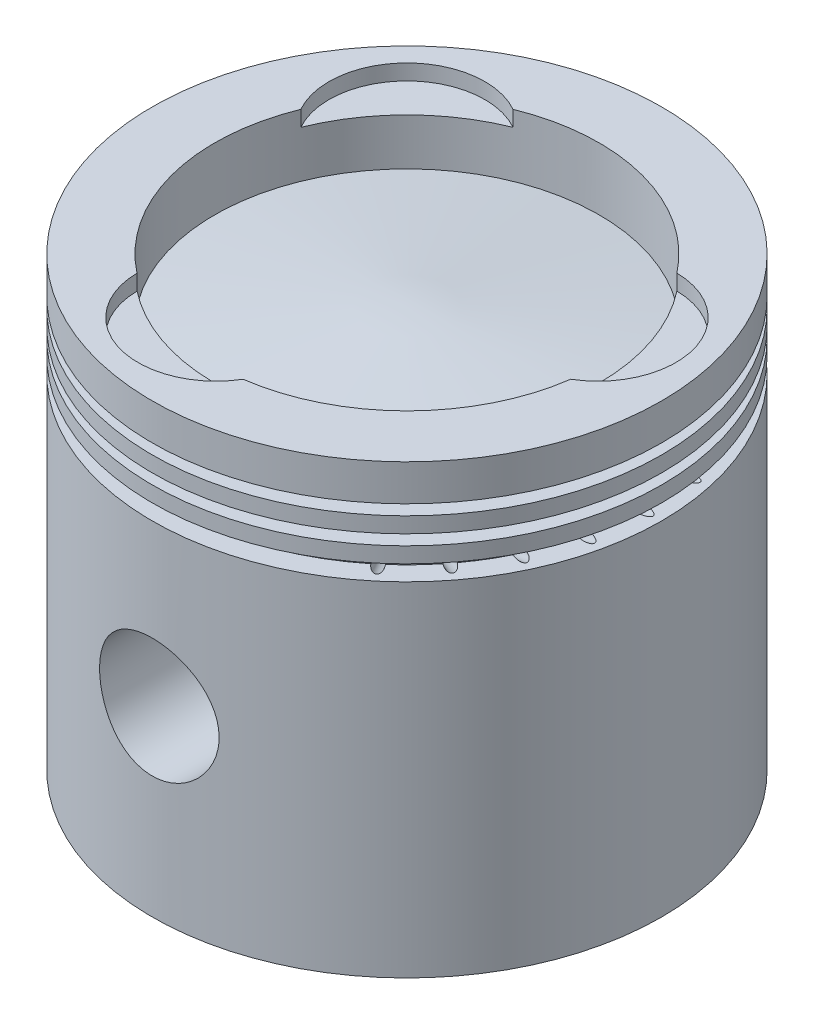
from build123d import *

# Parameters (mm, degrees)
SKETCH3_R               = 15
CUT_EXTRUDE1_DEPTH      = 3
CIRPATTERN1_COUNT       = 3
FILLET1_R               = 4
FILLET2_R               = 3
FILLET3_R               = 4
SKETCH4_R               = 11.5
CUT_EXTRUDE2_DEPTH      = 59.5
CUT_SWEEP1_PROFILE_R    = 1
CIRPATTERN2_COUNT       = 5
CIRPATTERN2_ANGLE       = 50
MIRROR2_COPY_1_SKETCH_R = 1
MIRROR2_COPY_2_SKETCH_R = 1
MIRROR2_COPY_3_SKETCH_R = 1
MIRROR2_COPY_4_SKETCH_R = 1
MIRROR2_COPY_5_SKETCH_R = 1


with BuildPart() as part:
    # Sketch1 → Revolve2 (revolve)
    with BuildSketch(Plane.XY):
        Polygon((49, 0), (49, 66), (45, 66), (45, 69), (49, 69), (49, 72), (45, 72), (45, 74), (49, 74), (49, 77), (45, 77), (45, 79), (49, 79), (49, 86), (37, 86), (37, 74), (0, 78), (0, 63), (39, 63), (39, 55.350212633), (20, 52), (20, 18), (45, 13.591825482), (45, 3), (42, 3), (42, 0), align=None)
    revolve(axis=Axis((0, -803.102363345, 0), (0, 1, 0)))

    # Sketch3 → Cut-Extrude1 (cut)
    with BuildSketch(Plane(origin=(0, 86, 0), x_dir=(1, 0, 0), z_dir=(0, 1, 0))):
        with Locations((-21.213203436, 21.213203436)):
            Circle(SKETCH3_R)
    cut_extrude1 = extrude(amount=-CUT_EXTRUDE1_DEPTH, mode=Mode.SUBTRACT)

    # CirPattern1: Cut-Extrude1 ×3 about axis
    cirpattern1_axis = Axis((0, 0, 0), (0, 1, 0))
    for i in range(1, CIRPATTERN1_COUNT):
        add(cut_extrude1.rotate(cirpattern1_axis, i * 360 / CIRPATTERN1_COUNT), mode=Mode.SUBTRACT)

    # Fillet1
    fillet1_edges = [part.edges().sort_by_distance(p)[0] for p in [
        (-39, 55.350212633, 0),
        (-39, 63, 0),
    ]]
    fillet(fillet1_edges, radius=FILLET1_R)

    # Fillet2
    fillet2_edges = [part.edges().sort_by_distance(p)[0] for p in [
        (-20, 18, 0),
        (-20, 52, 0),
    ]]
    fillet(fillet2_edges, radius=FILLET2_R)

    # Fillet3
    # the kernel refuses this fillet: 4 mm, written as the material it adds along each edge
    with BuildSketch(Plane(origin=(0, 3, 0), x_dir=(1, 0, 0), z_dir=(0, 0, 1))) as fillet3_piece_1:
        with BuildLine():
            CenterArc((41, 3.872983346), FILLET3_R, 284.477512186, 75.522487814)
            Line((42, 0), (42.02, -0.077459667))
            ThreePointArc((42.02, -0.077459667), (43.5, -0.08), (45, -0.08))
            Line((45, -0.08), (45.08, 0))
            Line((45.08, 0), (45.08, 3.872983346))
            Line((45.08, 3.872983346), (45, 3.872983346))
        make_face()
    revolve(axis=Axis((0, 3, 0), (0, 1, 0)))
    with BuildSketch(Plane(origin=(0, 13.591825482, 0), x_dir=(1, 0, 0), z_dir=(0, 0, 1))) as fillet3_piece_2:
        with BuildLine():
            CenterArc((45 - FILLET3_R, -FILLET3_R * 0.839099631177), FILLET3_R, 0, 80)
            Line((45, -FILLET3_R * 0.839099631177), (45 + FILLET3_R * 0.02, -FILLET3_R * 0.839099631177))
            Line((45 + FILLET3_R * 0.02, -FILLET3_R * 0.839099631177), (45 + FILLET3_R * 0.02, FILLET3_R * 0.0167819926235))
            Line((45 + FILLET3_R * 0.02, FILLET3_R * 0.0167819926235), (45 - FILLET3_R * 0.82287885878, FILLET3_R * 0.165404276895))
            Line((45 - FILLET3_R * 0.82287885878, FILLET3_R * 0.165404276895), (45 - FILLET3_R * 0.826351822333, FILLET3_R * 0.145708121835))
        make_face()
    revolve(axis=Axis((0, 13.591825482, 0), (0, 1, 0)))

    # Sketch4 → Cut-Extrude2 (cut, symmetric)
    with BuildSketch(Plane.XY):
        with Locations((0, 35)):
            Circle(SKETCH4_R)
    extrude(amount=CUT_EXTRUDE2_DEPTH, both=True, mode=Mode.SUBTRACT)

    # Cut-Sweep1: sweep along a path in Sketch5
    with BuildLine(Plane.XY) as cut_sweep1_path:
        Line((47.129385388, 66.992948713), (34.441076369, 61.076293049))
    # Cut-Sweep1 profile (on start of the path) → Cut-Sweep1 (sweep, cut)
    with BuildSketch(Plane(origin=(47.129385388, 66.992948713, 0), x_dir=(0.4226182617407051, -0.9063077870366474, 0), z_dir=(-0.9063077870366474, -0.4226182617407051, 0))):
        Circle(CUT_SWEEP1_PROFILE_R)
    cut_sweep1 = sweep(path=cut_sweep1_path.line, mode=Mode.SUBTRACT)

    # CirPattern2: Cut-Sweep1 ×5 about axis
    cirpattern2_axis = Axis((0, -803.102363345, 0), (0, -1, 0))
    for i in range(1, CIRPATTERN2_COUNT):
        add(cut_sweep1.rotate(cirpattern2_axis, i * CIRPATTERN2_ANGLE / (CIRPATTERN2_COUNT - 1)), mode=Mode.SUBTRACT)

    # Mirror2 copy 1: sweep along a path in Mirror2 copy 1 path
    with BuildLine(Plane(origin=(0, 0, 0), x_dir=(0.9762960071199333, 0, -0.21643961393810338), z_dir=(-0.21643961393810338, 0, -0.9762960071199333))) as mirror2_copy_1_path:
        Line((47.129385388, -66.992948713), (34.441076369, -61.076293049))
    # Mirror2 copy 1 sketch → Mirror2 copy 1 (sweep, cut)
    with BuildSketch(Plane(origin=(46.012230772, 66.992948713, -10.200665978), x_dir=(0.4126005214734173, -0.9063077870366474, -0.09147133341434986), z_dir=(-0.8848246737055816, -0.42261826174070505, 0.1961609075353091))):
        Circle(MIRROR2_COPY_1_SKETCH_R)
    sweep(path=mirror2_copy_1_path.line, mode=Mode.SUBTRACT)

    # Mirror2 copy 2: sweep along a path in Mirror2 copy 2 path
    with BuildLine(Plane(origin=(0, 0, 0), x_dir=(0.9063077870366495, 0, -0.42261826174070033), z_dir=(-0.42261826174070033, -1.4755637743219784e-15, -0.9063077870366495))) as mirror2_copy_2_path:
        Line((47.129385388, -66.992948713), (34.441076369, -61.076293049))
    # Mirror2 copy 2 sketch → Mirror2 copy 2 (sweep, cut)
    with BuildSketch(Plane(origin=(42.713728975, 66.992948713, -19.917738929), x_dir=(0.3830222215594942, -0.9063077870366475, -0.1786061951567318), z_dir=(-0.8213938048432667, -0.4226182617407048, 0.38302222155948934))):
        Circle(MIRROR2_COPY_2_SKETCH_R)
    sweep(path=mirror2_copy_2_path.line, mode=Mode.SUBTRACT)

    # Mirror2 copy 3: sweep along a path in Mirror2 copy 3 path
    with BuildLine(Plane(origin=(0, 0, 0), x_dir=(0.7933533402912343, 0, -0.6087614290087218), z_dir=(-0.6087614290087218, -2.125479169191431e-15, -0.7933533402912343))) as mirror2_copy_3_path:
        Line((47.129385388, -66.992948713), (34.441076369, -61.076293049))
    # Mirror2 copy 3 sketch → Mirror2 copy 3 (sweep, cut)
    with BuildSketch(Plane(origin=(37.390255323, 66.992948713, -28.690551997), x_dir=(0.3352856096200642, -0.9063077870366477, -0.2572736969424517), z_dir=(-0.7190223101774804, -0.42261826174070444, 0.5517252235581627))):
        Circle(MIRROR2_COPY_3_SKETCH_R)
    sweep(path=mirror2_copy_3_path.line, mode=Mode.SUBTRACT)

    # Mirror2 copy 4: sweep along a path in Mirror2 copy 4 path
    with BuildLine(Plane(origin=(0, 0, 0), x_dir=(0.6427876096865378, -1.247200394783003e-15, -0.7660444431189793), z_dir=(-0.7660444431189793, -2.6746298778743968e-15, -0.6427876096865378))) as mirror2_copy_4_path:
        Line((47.129385388, -66.992948713), (34.441076369, -61.076293049))
    # Mirror2 copy 4 sketch → Mirror2 copy 4 (sweep, cut)
    with BuildSketch(Plane(origin=(30.294184979, 66.992948713, -36.103203784), x_dir=(0.2716537822741885, -0.9063077870366479, -0.32374437096706704), z_dir=(-0.5825634160695817, -0.422618261740704, 0.6942720440148842))):
        Circle(MIRROR2_COPY_4_SKETCH_R)
    sweep(path=mirror2_copy_4_path.line, mode=Mode.SUBTRACT)

    # Mirror2 copy 5: sweep along a path in Mirror2 copy 5 path
    with BuildLine(Plane(origin=(0, 0, 0), x_dir=(1, 0, 0), z_dir=(0, 0, -1))) as mirror2_copy_5_path:
        Line((47.129385388, -66.992948713), (34.441076369, -61.076293049))
    # Mirror2 copy 5 sketch → Mirror2 copy 5 (sweep, cut)
    with BuildSketch(Plane(origin=(47.129385388, 66.992948713, 0), x_dir=(0.4226182617407051, -0.9063077870366474, 0), z_dir=(-0.9063077870366474, -0.4226182617407051, 0))):
        Circle(MIRROR2_COPY_5_SKETCH_R)
    sweep(path=mirror2_copy_5_path.line, mode=Mode.SUBTRACT)


solid = part.part
